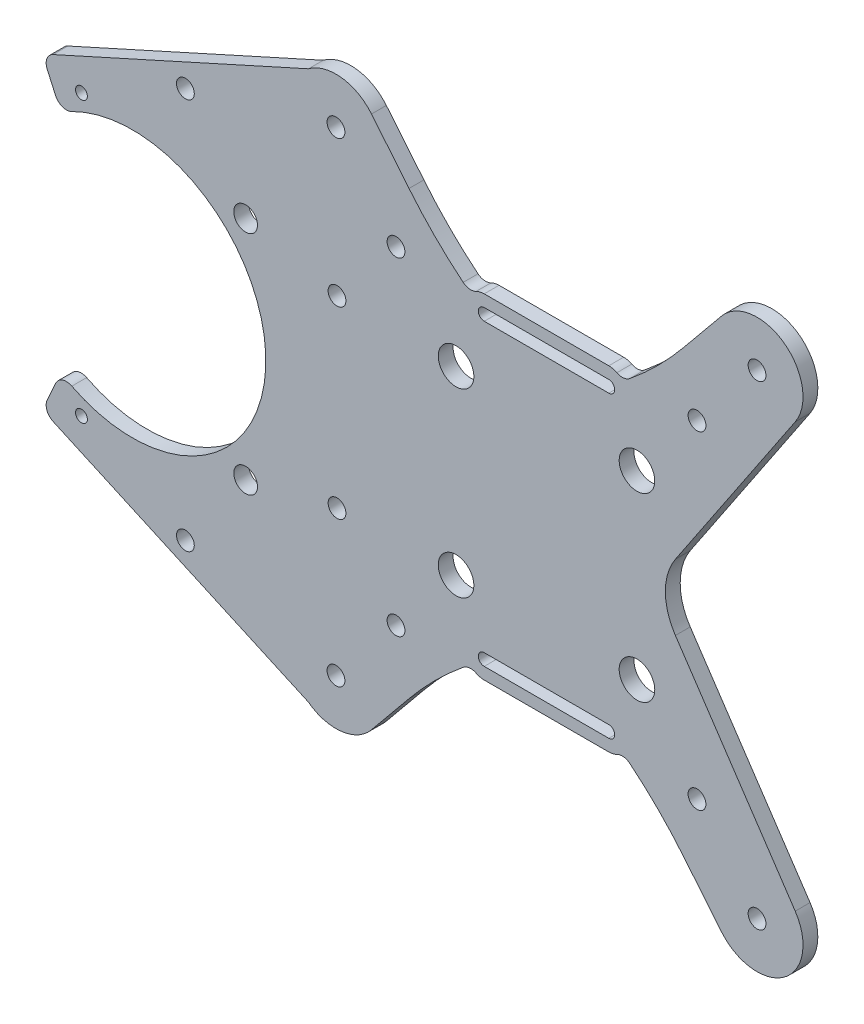
from build123d import *

# Parameters (mm, degrees)
CROQUIS1_R              = 2.25
CROQUIS1_R_2            = 3
CROQUIS1_R_3            = 1.5
CROQUIS1_R_4            = 2.249997567
SALIENTE_EXTRUIR1_DEPTH = 2.5
SALIENTE_EXTRUIR3_START = -2.5
CROQUIS6_R              = 2.250000066
CROQUIS6_R_2            = 1.5
CROQUIS6_R_3            = 2.25
SALIENTE_EXTRUIR3_DEPTH = 2.5
CROQUIS5_R              = 22.5
CROQUIS5_R_2            = 1
CROQUIS5_R_3            = 2
CORTAR_EXTRUIR5_DEPTH   = 2.5
CORTAR_EXTRUIR6_DEPTH   = 2.5
REDONDEO1_R             = 2
CROQUIS11_R             = 1.5
CROQUIS11_R_2           = 1.500000006
CORTAR_EXTRUIR7_DEPTH   = 2.5


with BuildPart() as part:
    # Croquis1 → Saliente-Extruir1 (new body)
    with BuildSketch(Plane.XY):
        with BuildLine():
            Line((-29.502526327, -44.949972179), (-23.17778065, -37.243838032))
            ThreePointArc((-23.17778065, -37.243838032), (-18.839723212, -32.444384768), (-14.046056443, -28.099933953))
            ThreePointArc((-14.046056443, -28.099933953), (-12.991422185, -27.658257217), (-11.867164621, -27.866527921))
            ThreePointArc((-11.867164621, -27.866527921), (-11.203313373, -28.112469078), (-10.500314, -28.196))
            Line((-10.500314, -28.196), (10.499686, -28.196))
            ThreePointArc((10.499686, -28.196), (11.203007921, -28.112542722), (11.867164264, -27.866528101))
            ThreePointArc((11.867164264, -27.866528101), (12.991422421, -27.658256674), (14.046057406, -28.099933523))
            ThreePointArc((14.046057406, -28.099933523), (18.839775902, -32.444337151), (23.177889012, -37.243749049))
            Line((23.177889012, -37.243749049), (29.502526012, -44.949972049))
            ThreePointArc((29.502526012, -44.949972049), (40.113877497, -46.255199126), (41.931739547, -35.719556022))
            Line((41.931739547, -35.719556022), (21.72923101, -5.566101046))
            ThreePointArc((21.72923101, -5.566101046), (20.036969431, -9.5e-08), (21.729230693, 5.566100954))
            Line((21.729230693, 5.566100954), (41.931739693, 35.719555954))
            ThreePointArc((41.931739693, 35.719555954), (40.113877277, 46.255198335), (29.502526336, 44.949972165))
            Line((29.502526336, 44.949972165), (23.17778065, 37.243838007))
            ThreePointArc((23.17778065, 37.243838007), (18.839723212, 32.444384742), (14.046056443, 28.099933927))
            ThreePointArc((14.046056443, 28.099933927), (12.991421988, 27.658257139), (11.867164252, 27.866528027))
            ThreePointArc((11.867164252, 27.866528027), (11.203313175, 28.112469073), (10.500314, 28.195999974))
            Line((10.500314, 28.195999974), (-10.500314, 28.195999974))
            ThreePointArc((-10.500314, 28.195999974), (-11.203313178, 28.112469098), (-11.867164264, 27.866528075))
            ThreePointArc((-11.867164264, 27.866528075), (-12.991422421, 27.658256648), (-14.046057406, 28.099933497))
            ThreePointArc((-14.046057406, 28.099933497), (-18.839775902, 32.444337126), (-23.177889012, 37.243749023))
            Line((-23.177889012, 37.243749023), (-29.502526012, 44.949972023))
            ThreePointArc((-29.502526012, 44.949972023), (-40.146302424, 46.230987494), (-41.886340556, 35.652554517))
            ThreePointArc((-41.886340556, 35.652554517), (-41.288874902, 25.337679941), (-50.13550001, 20.000000021))
            Line((-50.13550001, 20.000000021), (-97.31807601, 20.000000021))
            ThreePointArc((-97.31807601, 20.000000021), (-99.1994919, 19.554558541), (-100.681450855, 18.312809163))
            add(Edge.make_bspline(
                [(-107.31807554, 2.1e-08), (-107.252414123, 7.059743944), (-104.975710329, 13.164639039), (-100.681450855, 18.312809163)],
                knots=[0, 0, 0, 0, 1, 1, 1, 1], degree=3))
            add(Edge.make_bspline(
                [(-107.31807554, 2.1e-08), (-107.252414123, -7.059743902), (-104.975710329, -13.164638997), (-100.681450855, -18.312809121)],
                knots=[0, 0, 0, 0, 1, 1, 1, 1], degree=3))
            ThreePointArc((-100.681450855, -18.312809121), (-99.19949186, -19.554558345), (-97.31807601, -19.9999997))
            Line((-97.31807601, -19.9999997), (-50.13550001, -19.9999997))
            ThreePointArc((-50.13550001, -19.9999997), (-41.288874902, -25.33767962), (-41.886340556, -35.652554196))
            ThreePointArc((-41.886340556, -35.652554196), (-40.146302646, -46.230987042), (-29.502526327, -44.949972179))
        make_face()
        with Locations((-25.371621, 27.641642)):
            Circle(CROQUIS1_R, mode=Mode.SUBTRACT)
        with Locations((-35.493242035, 40.033284004)):
            Circle(CROQUIS1_R, mode=Mode.SUBTRACT)
        with Locations((-35.49324201, -40.0332837)):
            Circle(CROQUIS1_R, mode=Mode.SUBTRACT)
        with Locations((15.25, -15.25)):
            Circle(CROQUIS1_R_2, mode=Mode.SUBTRACT)
        with Locations((35.493242035, -40.03328403)):
            Circle(CROQUIS1_R, mode=Mode.SUBTRACT)
        with Locations((-15.25, 15.25)):
            Circle(CROQUIS1_R_2, mode=Mode.SUBTRACT)
        with Locations((-25.371621, -27.641642)):
            Circle(CROQUIS1_R, mode=Mode.SUBTRACT)
        with Locations((-35.318076, 15.5)):
            Circle(CROQUIS1_R_3, mode=Mode.SUBTRACT)
        with Locations((25.371621, -27.641642)):
            Circle(CROQUIS1_R, mode=Mode.SUBTRACT)
        with Locations((-15.25, -15.25)):
            Circle(CROQUIS1_R_2, mode=Mode.SUBTRACT)
        with Locations((-97.318076, 15.5)):
            Circle(CROQUIS1_R_3, mode=Mode.SUBTRACT)
        with Locations((15.25, 15.25)):
            Circle(CROQUIS1_R_2, mode=Mode.SUBTRACT)
        with Locations((-35.318076, -15.5)):
            Circle(CROQUIS1_R_3, mode=Mode.SUBTRACT)
        with Locations((25.371621, 27.641642)):
            Circle(CROQUIS1_R, mode=Mode.SUBTRACT)
        with Locations((-97.318076, -15.5)):
            Circle(CROQUIS1_R_3, mode=Mode.SUBTRACT)
        with Locations((35.493241695, 40.03328329)):
            Circle(CROQUIS1_R_4, mode=Mode.SUBTRACT)
        with BuildLine():
            Line((10.499686, -24.196), (-10.500314, -24.196))
            ThreePointArc((-10.500314, -24.196), (-11.500314, -25.196), (-10.500314, -26.196))
            Line((-10.500314, -26.196), (10.499686, -26.196))
            ThreePointArc((10.499686, -26.196), (11.499686, -25.196), (10.499686, -24.196))
        make_face(mode=Mode.SUBTRACT)
        with BuildLine():
            Line((10.499686, 24.196), (-10.500314, 24.196))
            ThreePointArc((-10.500314, 24.196), (-11.500314, 25.196), (-10.500314, 26.196))
            Line((-10.500314, 26.196), (10.499686, 26.196))
            ThreePointArc((10.499686, 26.196), (11.499686, 25.196), (10.499686, 24.196))
        make_face(mode=Mode.SUBTRACT)
    extrude(amount=SALIENTE_EXTRUIR1_DEPTH)


with BuildPart() as saliente_extruir3_tool:
    # Croquis6 → Saliente-Extruir3 (new body)
    # profile 1 of 10: a face of its own
    with BuildSketch(Plane.XY.offset(2.5).offset(SALIENTE_EXTRUIR3_START)):
        with Locations((-35.493242163, 40.033284025)):
            Circle(CROQUIS6_R)
        with Locations((-35.493242163, 40.033284025)):
            Circle(CROQUIS6_R_2, mode=Mode.SUBTRACT)
    # profile 2 of 10: a face of its own
    with BuildSketch(Plane.XY.offset(2.5).offset(SALIENTE_EXTRUIR3_START)):
        with Locations((-25.371621, 27.641642)):
            Circle(CROQUIS6_R_3)
        with Locations((-25.371621, 27.641642)):
            Circle(CROQUIS6_R_2, mode=Mode.SUBTRACT)
    # profile 3 of 10: a face of its own
    with BuildSketch(Plane.XY.offset(2.5).offset(SALIENTE_EXTRUIR3_START)):
        with Locations((25.371621, 27.641642)):
            Circle(CROQUIS6_R_3)
        with Locations(Location((25.371621, 27.641642, 0), (0, 0, 180))):
            Circle(CROQUIS6_R_2, mode=Mode.SUBTRACT)
    # profile 4 of 10: a face of its own
    with BuildSketch(Plane.XY.offset(2.5).offset(SALIENTE_EXTRUIR3_START)):
        with Locations((35.493242163, 40.033284025)):
            Circle(CROQUIS6_R)
        with Locations(Location((35.493242163, 40.033284025, 0), (0, 0, 180))):
            Circle(CROQUIS6_R_2, mode=Mode.SUBTRACT)
    # profile 5 of 10: a face of its own
    with BuildSketch(Plane.XY.offset(2.5).offset(SALIENTE_EXTRUIR3_START)):
        with Locations((35.493242163, -40.033284025)):
            Circle(CROQUIS6_R)
        with Locations((35.493242163, -40.033284025)):
            Circle(CROQUIS6_R_2, mode=Mode.SUBTRACT)
    # profile 6 of 10: a face of its own
    with BuildSketch(Plane.XY.offset(2.5).offset(SALIENTE_EXTRUIR3_START)):
        with Locations((25.371621, -27.641642)):
            Circle(CROQUIS6_R_3)
        with Locations((25.371621, -27.641642)):
            Circle(CROQUIS6_R_2, mode=Mode.SUBTRACT)
    # profile 7 of 10: a face of its own
    with BuildSketch(Plane.XY.offset(2.5).offset(SALIENTE_EXTRUIR3_START)):
        with Locations((-25.371621, -27.641642)):
            Circle(CROQUIS6_R_3)
        with Locations(Location((-25.371621, -27.641642, 0), (0, 0, 180))):
            Circle(CROQUIS6_R_2, mode=Mode.SUBTRACT)
    # profile 8 of 10: a face of its own
    with BuildSketch(Plane.XY.offset(2.5).offset(SALIENTE_EXTRUIR3_START)):
        with Locations((-35.493242163, -40.033284025)):
            Circle(CROQUIS6_R)
        with Locations(Location((-35.493242163, -40.033284025, 0), (0, 0, 180))):
            Circle(CROQUIS6_R_2, mode=Mode.SUBTRACT)
    # profile 9 of 10: a face of its own
    with BuildSketch(Plane.XY.offset(2.5).offset(SALIENTE_EXTRUIR3_START)):
        with BuildLine():
            Line((-99.1994919, 19.554558541), (-40.146302424, 46.230987494))
            ThreePointArc((-40.146302424, 46.230987494), (-43.140478024, 41.291171845), (-41.886340556, 35.652554517))
            ThreePointArc((-41.886340556, 35.652554517), (-41.288875033, 25.33768001), (-50.13550001, 20.000000021))
            Line((-50.13550001, 20.000000021), (-97.31807601, 20.000000021))
            ThreePointArc((-97.31807601, 20.000000021), (-98.214581153, 19.590579436), (-99.1994919, 19.554558541))
        make_face()
    # profile 10 of 10: a face of its own
    with BuildSketch(Plane.XY.offset(2.5).offset(SALIENTE_EXTRUIR3_START)):
        with BuildLine():
            Line((-50.13550001, -20.000000021), (-97.31807601, -20.000000021))
            ThreePointArc((-97.31807601, -20.000000021), (-98.214581153, -19.590579436), (-99.1994919, -19.554558541))
            Line((-99.1994919, -19.554558541), (-40.146302424, -46.230987494))
            ThreePointArc((-40.146302424, -46.230987494), (-43.140478024, -41.291171845), (-41.886340556, -35.652554517))
            ThreePointArc((-41.886340556, -35.652554517), (-41.288875033, -25.33768001), (-50.13550001, -20.000000021))
        make_face()
    extrude(amount=SALIENTE_EXTRUIR3_DEPTH)


with BuildPart() as part_1:
    add(part.part)


with BuildPart() as part_2:
    # Saliente-Extruir3: joined with saliente_extruir3_tool
    add(part_1.part.fuse(saliente_extruir3_tool.part, tol=0.00001))

    # Croquis5 → Cortar-Extruir5 (cut)
    with BuildSketch(Plane.XY.offset(2.5)):
        with Locations((-69.81807554, 2.1e-08)):
            Circle(CROQUIS5_R)
        with Locations((-78.402781137, 23.586284803)):
            Circle(CROQUIS5_R_2)
        with Locations((-94.91807554, 2.1e-08)):
            Circle(CROQUIS5_R_2)
        with Locations(Location((-78.402781137, -23.586284761, 0), (0, 0, 180))):
            Circle(CROQUIS5_R_2)
        with Locations((-50.726192448, 19.091883113)):
            Circle(CROQUIS5_R_3)
        with Locations(Location((-50.726192448, -19.091883071, 0), (0, 0, 180))):
            Circle(CROQUIS5_R_3)
    extrude(amount=-CORTAR_EXTRUIR5_DEPTH, mode=Mode.SUBTRACT)

    # Croquis10 → Cortar-Extruir6 (cut)
    with BuildSketch(Plane.XY.offset(2.5)):
        with BuildLine():
            Line((-81.857336743, 19.008055936), (-85.001521285, 25.96828755))
            ThreePointArc((-85.001521285, 25.96828755), (-102.968648752, 18.835514529), (-107.31807554, 2.1e-08))
            ThreePointArc((-107.31807554, 2.1e-08), (-102.968648773, -18.835514521), (-85.001521285, -25.96828755))
            Line((-85.001521285, -25.96828755), (-81.857336743, -19.008055936))
            ThreePointArc((-81.857336743, -19.008055936), (-92.318075557, 0), (-81.857336743, 19.008055936))
        make_face()
    extrude(amount=-CORTAR_EXTRUIR6_DEPTH, mode=Mode.SUBTRACT)

    # Redondeo1
    redondeo1_edges = [part_2.edges().sort_by_distance(p)[0] for p in [
        (-81.857336743, -19.008055936, 1.25),
        (-85.001521285, -25.96828755, 1.25),
        (-85.001521285, 25.96828755, 1.25),
        (-81.857336743, 19.008055936, 1.25),
    ]]
    fillet(redondeo1_edges, radius=REDONDEO1_R)

    # Croquis11 → Cortar-Extruir7 (cut)
    with BuildSketch(Plane.XY.offset(2.5)):
        with Locations((-60.881562628, 32.984594162)):
            Circle(CROQUIS11_R)
        with Locations((-60.881562628, -32.984594162)):
            Circle(CROQUIS11_R_2)
    extrude(amount=-CORTAR_EXTRUIR7_DEPTH, mode=Mode.SUBTRACT)


solid = part_2.part
